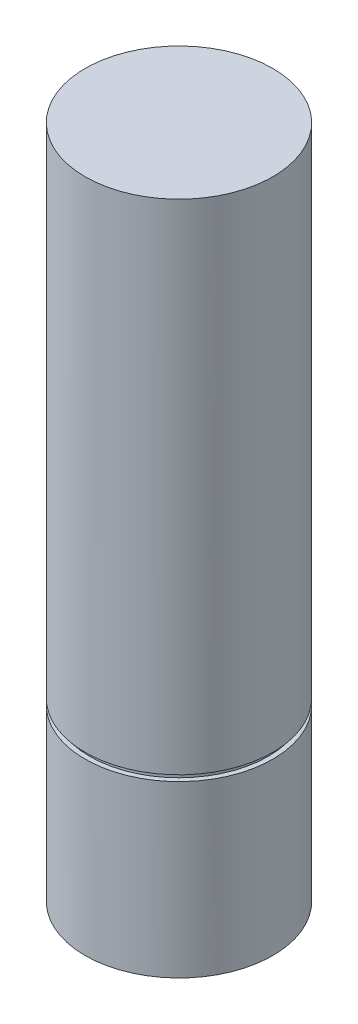
from build123d import *

# Parameters (mm, degrees)
SKETCH1_R           = 16
BOSS_EXTRUDE1_DEPTH = 115
CUT_EXTRUDE2_START  = -29
SKETCH2_R           = 16
SKETCH2_R_2         = 15.2
CUT_EXTRUDE2_DEPTH  = 1


with BuildPart() as part:
    # Sketch1 → Boss-Extrude1 (new body)
    with BuildSketch(Plane(origin=(0, 0, 0), x_dir=(1, 0, 0), z_dir=(0, 1, 0))):
        Circle(SKETCH1_R)
    extrude(amount=BOSS_EXTRUDE1_DEPTH)

    # Sketch2 → Cut-Extrude2 (cut)
    with BuildSketch(Plane.XZ.offset(CUT_EXTRUDE2_START)):
        Circle(SKETCH2_R)
        Circle(SKETCH2_R_2, mode=Mode.SUBTRACT)
    extrude(amount=-CUT_EXTRUDE2_DEPTH, mode=Mode.SUBTRACT)


solid = part.part
